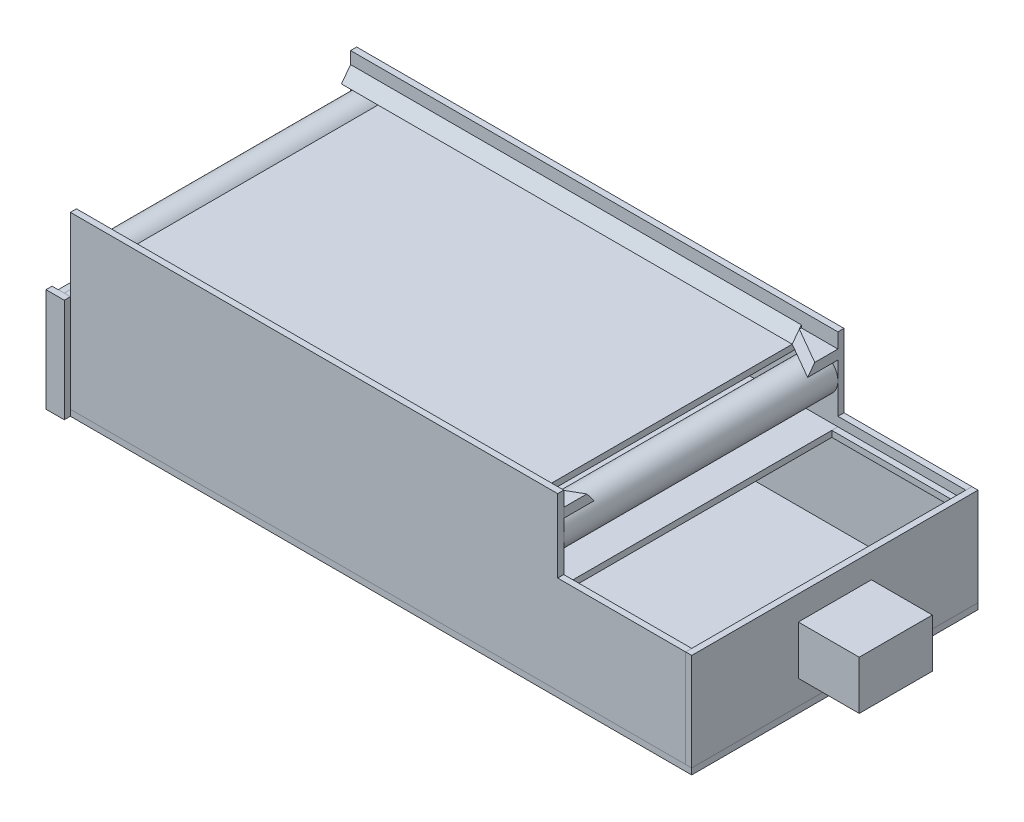
from build123d import *

# Parameters (mm, degrees)
SKETCH1_W                             = 1016
SKETCH1_H                             = 596.9
SKETCH1_W_2                           = 304.8
FOND_DEPTH                            = 12.7
SKETCH2_W                             = 1295.4
SKETCH2_H                             = 12.7
COT_S_HAUT_DEPTH                      = 203.2
COT_S_HAUT_2_DEPTH                    = 203.2
SKETCH3_W                             = 12.7
SKETCH3_H                             = 596.9
COT_ES_BAS_DEPTH                      = 203.2
COT_ES_BAS_2_DEPTH                    = 203.2
SKETCH4_W                             = 1016
SKETCH4_H                             = 12.7
SUPPORT_CAGE_DEPTH                    = 152.4
SKETCH5_W                             = 12.7
SKETCH5_H                             = 12.7
SUPPORT_TRAPPE_COT_ES_DEPTH           = 266.7
SUPPORT_TRAPPE_COT_ES_2_DEPTH         = 266.7
SUPPORT_TRAPPE_DEVANT_REACH           = 1061.67
SKETCH6_W                             = 12.7
SKETCH6_H                             = 12.7
PLANCHER_MILLIEU_REACH                = 1068.573
SKETCH7_W                             = 1028.7
SKETCH7_H                             = 12.7
ROULEAU_REACH                         = 1068.573
SKETCH8_R                             = 38.1
SKETCH10_W                            = 863.6
SKETCH10_H                            = 12.7
SOUTIEN_TAPIS_DEPTH                   = 571.5
REBORD_START                          = -1016
REBORD_TAPIS_DEPTH                    = 939.8
V_POUR_VIS_SANS_FIN_DEPTH             = 171.45
SKETCH14_W                            = 152.4
SKETCH14_H                            = 101.6
MOTEUR_VIS_SANS_FIN_DEPTH             = 127
TROU_V_VIS_SANS_FIN_REACH             = 1054.588
SKETCH17_W                            = 12.7
SKETCH17_H                            = 38.1
TROU_V_VIS_SANS_FIN_DIRECTION_2_REACH = 1054.588
TROU_SORTIE_VIS_SANS_FIN_DEPTH        = 12.7
TROU_SORTIE_VIS_SANS_FIN_DEPTH_BACK   = 12.7
SKETCH18_W                            = 127
SKETCH18_H                            = 38.1
REBORD_START_2                        = -25.4
REBORD_POUR_SAC_POUBELLE_DEPTH        = 38.1


with BuildPart() as part:
    # Sketch1 → Fond (new body)
    with BuildSketch(Plane(origin=(0, 0, 0), x_dir=(1, 0, 0), z_dir=(0, 1, 0))):
        Rectangle(SKETCH1_W, SKETCH1_H)
        with Locations((660.4, 0)):
            Rectangle(SKETCH1_W_2, SKETCH1_H)
    extrude(amount=FOND_DEPTH)


with BuildPart() as body_2:
    # Sketch2 → Cotés Haut (new body)
    with BuildSketch(Plane(origin=(0, 12.7, 0), x_dir=(1, 0, 0), z_dir=(0, 1, 0))):
        with Locations((152.4, 292.1)):
            Rectangle(SKETCH2_W, SKETCH2_H)
    extrude(amount=COT_S_HAUT_DEPTH)



with BuildPart() as body_3:
    # Sketch2 → Cot_s Haut 2 (new body)
    with BuildSketch(Plane(origin=(0, 12.7, 0), x_dir=(1, 0, 0), z_dir=(0, 1, 0))):
        with Locations((152.4, -292.1)):
            Rectangle(SKETCH2_W, SKETCH2_H)
    extrude(amount=COT_S_HAUT_2_DEPTH)


with BuildPart() as body_4:
    # Sketch3 → Cotées Bas (new body)
    with BuildSketch(Plane(origin=(0, 12.7, 0), x_dir=(1, 0, 0), z_dir=(0, 1, 0))):
        with Locations((-501.65, 0)):
            Rectangle(SKETCH3_W, SKETCH3_H)
    extrude(amount=COT_ES_BAS_DEPTH)


with BuildPart() as body_5:
    # Sketch3 → Cot_es Bas 2 (new body)
    with BuildSketch(Plane(origin=(0, 12.7, 0), x_dir=(1, 0, 0), z_dir=(0, 1, 0))):
        with Locations((806.45, 0)):
            Rectangle(SKETCH3_W, SKETCH3_H)
    extrude(amount=COT_ES_BAS_2_DEPTH)

    # Sketch18 → Trou sortie vis sans fin (cut, two sides: drawn at the far end of the back side and taken through both)
    with BuildSketch(Plane.XY.offset(-TROU_SORTIE_VIS_SANS_FIN_DEPTH_BACK)):
        with Locations((863.6, 98.425)):
            Rectangle(SKETCH18_W, SKETCH18_H)
    extrude(amount=TROU_SORTIE_VIS_SANS_FIN_DEPTH + TROU_SORTIE_VIS_SANS_FIN_DEPTH_BACK, mode=Mode.SUBTRACT)


with BuildPart() as body_2_1:
    add(body_2.part)

    add(body_3.part)  # Support Cage merges body 3
    # Sketch4 → Support Cage (add)
    with BuildSketch(Plane(origin=(0, 215.9, 0), x_dir=(1, 0, 0), z_dir=(0, 1, 0))):
        with Locations((25.4, 292.1)):
            Rectangle(SKETCH4_W, SKETCH4_H)
        with Locations((25.4, -292.1)):
            Rectangle(SKETCH4_W, SKETCH4_H)
    extrude(amount=SUPPORT_CAGE_DEPTH)


with BuildPart() as body_5_2:
    # Sketch5 → Support Trappe cotées (new body)
    with BuildSketch(Plane.ZY.offset(-800.1)):
        with Locations((-279.4, 190.5)):
            Rectangle(SKETCH5_W, SKETCH5_H)
    extrude(amount=SUPPORT_TRAPPE_COT_ES_DEPTH)


with BuildPart() as body_6:
    # Sketch5 → Support Trappe cot_es 2 (new body)
    with BuildSketch(Plane.ZY.offset(-800.1)):
        with Locations((279.4, 190.5)):
            Rectangle(SKETCH5_W, SKETCH5_H)
    extrude(amount=SUPPORT_TRAPPE_COT_ES_2_DEPTH)


with BuildPart() as body_7:

    # Sketch6 → Support Trappe devant (new, up to next)
    with BuildSketch(Plane.XY.offset(-273.05), mode=Mode.PRIVATE) as support_trappe_devant_sk1:
        with Locations((793.75, 190.5)):
            Rectangle(SKETCH6_W, SKETCH6_H)
    support_trappe_devant_tool1 = extrude(support_trappe_devant_sk1.sketch, amount=SUPPORT_TRAPPE_DEVANT_REACH, mode=Mode.PRIVATE) - body_6.part
    add(support_trappe_devant_tool1.solids().sort_by_distance((793.75, 190.5, -273.05))[0])


with BuildPart() as body_8:

    # Sketch7 → Plancher millieu (new, up to next)
    with BuildSketch(Plane(origin=(0, 0, 285.75), x_dir=(-1, 0, 0), z_dir=(0, 0, -1)), mode=Mode.PRIVATE) as plancher_millieu_sk1:
        with Locations((-19.05, 190.5)):
            Rectangle(SKETCH7_W, SKETCH7_H)
    plancher_millieu_tool1 = extrude(plancher_millieu_sk1.sketch, amount=PLANCHER_MILLIEU_REACH, mode=Mode.PRIVATE) - body_2_1.part
    add(plancher_millieu_tool1.solids().sort_by_distance((19.05, 190.5, 285.75))[0])


with BuildPart() as body_9:

    # Sketch8 → Rouleau (new, up to next)
    with BuildSketch(Plane(origin=(0, 0, 285.75), x_dir=(-1, 0, 0), z_dir=(0, 0, -1)), mode=Mode.PRIVATE) as rouleau_sk1:
        with Locations((-495.3, 279.4)):
            Circle(SKETCH8_R)
    rouleau_tool1 = extrude(rouleau_sk1.sketch, amount=ROULEAU_REACH, mode=Mode.PRIVATE) - body_2_1.part
    rouleau = rouleau_tool1.solids().sort_by_distance((495.3, 279.4, 285.75))[0]
    add(rouleau)


with BuildPart() as body_2_2:
    add(body_2_1.part)

    # Mirror1: Rouleau across plane
    add(rouleau.mirror(Plane(origin=(25.4, 0, 0), x_dir=(0, 0, 1), z_dir=(1, 0, 0))))

    # Mirror9 2: loft between two sections, ruled curve by curve
    mirror9_2_from = [
        Edge.make_line((533.4, 337.312, -237.564909488), (533.4, 337.312, -285.75)),
        Edge.make_line((533.4, 317.5, -285.75), (533.4, 317.5, -222.705909488)),
        Edge.make_line((533.4, 317.5, -222.705909488), (533.4, 337.312, -237.564909488)),
        Edge.make_line((533.4, 317.5, -285.75), (533.4, 337.312, -285.75)),
    ]
    mirror9_2_to = [
        Edge.make_line((457.2, 337.312, -281.559), (457.2, 337.312, -285.75)),
        Edge.make_line((457.2, 317.5, -285.75), (457.2, 317.5, -266.7)),
        Edge.make_line((457.2, 317.5, -266.7), (457.2, 337.312, -281.559)),
        Edge.make_line((457.2, 317.5, -285.75), (457.2, 337.312, -285.75)),
    ]
    mirror9_2 = Solid(Shell([*[Face.make_surface_from_curves(mirror9_2_from[k], mirror9_2_to[k]) for k in range(4)], Face(Wire(mirror9_2_from)), Face(Wire(mirror9_2_to))]))
    add(mirror9_2)


with BuildPart() as body_10:
    # Sketch10 → Soutien tapis (new body)
    with BuildSketch(Plane(origin=(0, 0, 285.75), x_dir=(-1, 0, 0), z_dir=(0, 0, -1))):
        with Locations((-25.4, 311.15)):
            Rectangle(SKETCH10_W, SKETCH10_H)
    extrude(amount=SOUTIEN_TAPIS_DEPTH)


with BuildPart() as body_11:
    # Rebord tapis: read off the stored shape, not the designer's step
    # Rebord tapis outline → Rebord tapis (new body)
    with BuildSketch(Plane(origin=(533.4, 0, 0), x_dir=(0, 0, -1), z_dir=(1, 0, 0)).offset(REBORD_START)):
        Polygon((-285.75, 317.5), (-266.7, 317.5), (-285.75, 342.9), align=None)
    rebord_tapis = extrude(amount=REBORD_TAPIS_DEPTH)


with BuildPart() as body_10_1:
    add(body_10.part)

    # Mirror5: Rebord tapis across plane
    add(rebord_tapis.mirror(Plane.XY))

    # Mirror9: read off the stored shape, not the designer's step
    # Mirror9: loft between two sections, ruled curve by curve
    mirror9_from = [
        Edge.make_line((533.4, 317.5, -285.75), (533.4, 317.5, -222.705909488)),
        Edge.make_line((533.4, 337.312, -237.564909488), (533.4, 337.312, -285.75)),
        Edge.make_line((533.4, 317.5, -222.705909488), (533.4, 337.312, -237.564909488)),
        Edge.make_line((533.4, 337.312, -285.75), (533.4, 317.5, -285.75)),
    ]
    mirror9_to = [
        Edge.make_line((457.2, 317.5, -285.75), (457.2, 317.5, -266.7)),
        Edge.make_line((457.2, 337.312, -281.559), (457.2, 337.312, -285.75)),
        Edge.make_line((457.2, 317.5, -266.7), (457.2, 337.312, -281.559)),
        Edge.make_line((457.2, 337.312, -285.75), (457.2, 317.5, -285.75)),
    ]
    mirror9 = Solid(Shell([*[Face.make_surface_from_curves(mirror9_from[k], mirror9_to[k]) for k in range(4)], Face(Wire(mirror9_from)), Face(Wire(mirror9_to))]))
    add(mirror9)


with BuildPart() as body_12:
    # Sketch13 → V pour vis sans fin (new body)
    with BuildSketch(Plane(origin=(0, 12.7, 0), x_dir=(1, 0, 0), z_dir=(0, 1, 0))):
        Polygon((-451.305909488, 0), (-495.3, 25.4), (-495.3, -25.4), align=None)
    extrude(amount=V_POUR_VIS_SANS_FIN_DEPTH)

    # Trou V vis sans fin: up to this face of the body (flat: up to its plane)
    trou_v_vis_sans_fin_end = Plane(body_12.part.faces().sort_by_distance((-473.302954744, 98.425, -12.7))[0])
    # Sketch17 → Trou V vis sans fin (cut, up to the picked face)
    with BuildSketch(Plane.XY, mode=Mode.PRIVATE) as trou_v_vis_sans_fin_sk1:
        with Locations((-457.655909488, 98.425)):
            Rectangle(SKETCH17_W, SKETCH17_H)
    trou_v_vis_sans_fin_tool1 = split(extrude(trou_v_vis_sans_fin_sk1.sketch, amount=-TROU_V_VIS_SANS_FIN_REACH, mode=Mode.PRIVATE), bisect_by=trou_v_vis_sans_fin_end, keep=Keep.BOTH, mode=Mode.PRIVATE)
    add(trou_v_vis_sans_fin_tool1.solids().sort_by(Axis((-457.655909, 98.425, 0), (0, 0, -1)))[0], mode=Mode.SUBTRACT)

    # Trou V vis sans fin direction 2: up to this face of the body (flat: up to its plane)
    trou_v_vis_sans_fin_direction_2_end = Plane(body_12.part.faces().sort_by_distance((-473.302954744, 98.425, 12.7))[0])
    # Sketch17 → Trou V vis sans fin direction 2 (cut, up to the picked face)
    with BuildSketch(Plane.XY, mode=Mode.PRIVATE) as trou_v_vis_sans_fin_direction_2_sk1:
        with Locations((-457.655909488, 98.425)):
            Rectangle(SKETCH17_W, SKETCH17_H)
    trou_v_vis_sans_fin_direction_2_tool1 = split(extrude(trou_v_vis_sans_fin_direction_2_sk1.sketch, amount=TROU_V_VIS_SANS_FIN_DIRECTION_2_REACH, mode=Mode.PRIVATE), bisect_by=trou_v_vis_sans_fin_direction_2_end, keep=Keep.BOTH, mode=Mode.PRIVATE)
    add(trou_v_vis_sans_fin_direction_2_tool1.solids().sort_by(Axis((-457.655909, 98.425, 0), (0, 0, 1)))[0], mode=Mode.SUBTRACT)


with BuildPart() as body_13:
    # Sketch14 → Moteur vis sans fin (new body)
    with BuildSketch(Plane(origin=(812.8, 0, 0), x_dir=(0, 0, -1), z_dir=(1, 0, 0))):
        with Locations((0, 114.3)):
            Rectangle(SKETCH14_W, SKETCH14_H)
    extrude(amount=MOTEUR_VIS_SANS_FIN_DEPTH)


with BuildPart() as body_14:
    # Sketch19 → Rebord pour sac poubelle (new body)
    with BuildSketch(Plane.ZY.offset(508).offset(REBORD_START_2)):
        Polygon((298.45, 215.9), (311.15, 215.9), (311.15, 0), (298.45, 0), (-298.45, 0), (-311.15, 0), (-311.15, 215.9), (-298.45, 215.9), (-298.45, 12.7), (298.45, 12.7), align=None)
    extrude(amount=REBORD_POUR_SAC_POUBELLE_DEPTH)


with BuildPart() as body_15:
    # Sweep7: read off the stored shape, not the designer's step
    # Sweep7: loft between two sections, ruled curve by curve
    sweep7_from = [
        Edge.make_line((457.2, 317.5, 266.7), (457.2, 317.5, 285.75)),
        Edge.make_line((457.2, 317.5, 285.75), (533.4, 317.5, 285.75)),
        Edge.make_line((533.4, 317.5, 222.705909488), (457.2, 317.5, 266.7)),
        Edge.make_line((533.4, 317.5, 285.75), (533.4, 317.5, 222.705909488)),
    ]
    sweep7_to = [
        Edge.make_line((457.2, 337.312, 281.559), (457.2, 337.312, 285.75)),
        Edge.make_line((457.2, 337.312, 285.75), (533.4, 337.312, 285.75)),
        Edge.make_line((533.4, 337.312, 237.564909488), (457.2, 337.312, 281.559)),
        Edge.make_line((533.4, 337.312, 285.75), (533.4, 337.312, 237.564909488)),
    ]
    sweep7 = Solid(Shell([*[Face.make_surface_from_curves(sweep7_from[k], sweep7_to[k]) for k in range(4)], Face(Wire(sweep7_from)), Face(Wire(sweep7_to))]))
    add(sweep7)


solid = Compound([part.part, body_4.part, body_5.part, body_5_2.part, body_6.part, body_7.part, body_8.part, body_9.part, body_2_2.part, body_11.part, body_10_1.part, body_12.part, body_13.part, body_14.part, body_15.part])
